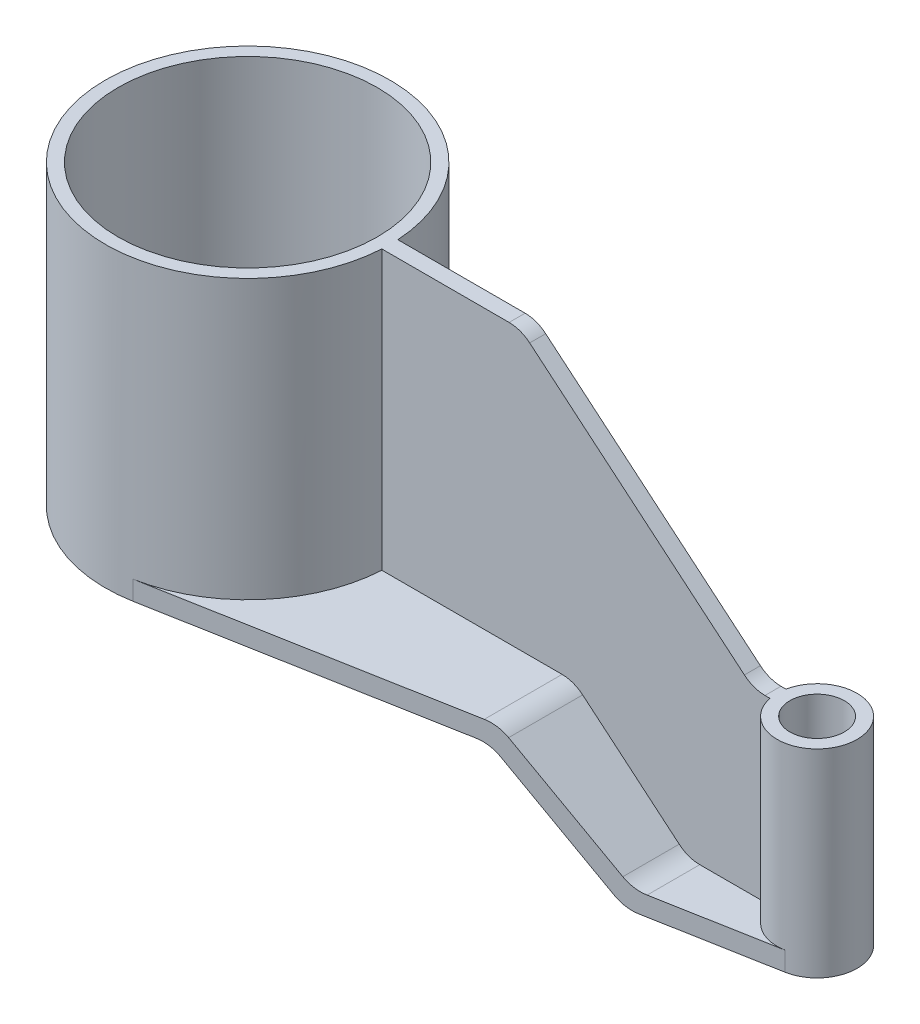
from build123d import *
from build123d.topology import SkipClean

# Parameters (mm, degrees)
SKETCH2_R                = 44.5
BOSS_EXTRUDE1_DEPTH      = 93
BOSS_EXTRUDE2_START      = -30
SKETCH2_3_R              = 12.5
BOSS_EXTRUDE2_DEPTH      = 62
EXTRUDE_THIN1_DEPTH      = 115
CUT_EXTRUDE1_START       = -30
CUT_EXTRUDE1_OUTLINE_R   = 8.5
CUT_EXTRUDE1_OUTLINE_R_2 = 40.5
CUT_EXTRUDE1_DEPTH       = 123
RIB1_START               = -2.5
RIB1_DEPTH               = 5
FILLET1_R                = 10


# Read off the part's stored shape, not the designer's step: Cut-Extrude1, Rib1
with BuildPart() as part:
    # Sketch2 → Boss-Extrude1 (new body)
    with BuildSketch(Plane(origin=(0, 0, 0), x_dir=(1, 0, 0), z_dir=(0, 1, 0))):
        with Locations(Location((0, 0, 0), (0, 0, 90))):
            Circle(SKETCH2_R)
    extrude(amount=BOSS_EXTRUDE1_DEPTH)



with BuildPart() as body_2:
    # Sketch2<3> → Boss-Extrude2 (new body)
    with BuildSketch(Plane(origin=(0, 0, 0), x_dir=(1, 0, 0), z_dir=(0, 1, 0)).offset(BOSS_EXTRUDE2_START)):
        with Locations(Location((178, 0, 0), (0, 0, 270))):
            Circle(SKETCH2_3_R)
    extrude(amount=BOSS_EXTRUDE2_DEPTH)


with BuildPart() as part_1:
    add(part.part)

    add(body_2.part)  # Extrude-Thin1 merges body 2
    # Sketch3 → Extrude-Thin1 (add, symmetric)
    with BuildSketch(Plane.XY):
        Polygon((-44.5, 0), (102.247392222, 0), (138, -30), (190.5, -30), (190.5, -24), (140.183821406, -24), (104.431213628, 6), (-44.5, 6), align=None)
    extrude(amount=EXTRUDE_THIN1_DEPTH, both=True)

    # Cut-Extrude1 outline → Cut-Extrude1 (cut)
    with SkipClean():  # the faces are left unmerged after this step: merging them gives an invalid solid
        with BuildSketch(Plane(origin=(0, 0, 0), x_dir=(1, 0, 0), z_dir=(0, 1, 0)).offset(CUT_EXTRUDE1_START)):
            with Locations((178, 0)):
                Circle(CUT_EXTRUDE1_OUTLINE_R)
            with BuildLine():
                ThreePointArc((-44.5, 0), (-28.497806933, 34.1778437), (8, 43.774992861))
                Line((8, 43.774992861), (180.247191011, 12.296346309))
                ThreePointArc((180.247191011, 12.296346309), (187.600517893, 8.005001948), (190.5, 0))
                Line((190.5, 0), (190.5, 115))
                Line((190.5, 115), (-44.5, 115))
                Line((-44.5, 115), (-44.5, 0))
            make_face()
            with BuildLine():
                ThreePointArc((8, -43.774992861), (-28.497806933, -34.1778437), (-44.5, 0))
                Line((-44.5, 0), (-44.5, -115))
                Line((-44.5, -115), (190.5, -115))
                Line((190.5, -115), (190.5, 0))
                ThreePointArc((190.5, 0), (187.600517893, -8.005001948), (180.247191011, -12.296346309))
                Line((180.247191011, -12.296346309), (8, -43.774992861))
            make_face()
            Circle(CUT_EXTRUDE1_OUTLINE_R_2)
        extrude(amount=CUT_EXTRUDE1_DEPTH, mode=Mode.SUBTRACT)

    # Rib1 outline → Rib1 (add)
    with BuildSketch(Plane.XY.offset(RIB1_START)):
        Polygon((160.566154525, 32), (87.869185376, 93), (43, 93), (43, 6), (104.431213628, 6), (140.183821406, -24), (167, -24), (167, 32), align=None)
    extrude(amount=RIB1_DEPTH)

    # Fillet1
    fillet1_edges = [part_1.edges().sort_by_distance(p)[0] for p in [
        (140.183821406, -24, -11.05901849),
        (104.431213628, 6, -14.325962052),
        (160.566154525, 32, 0),
        (87.869185376, 93, 0),
        (102.247392222, 0, 0),
        (104.431213628, 6, 14.325962052),
        (140.183821406, -24, 11.05901849),
        (138, -30, 0),
    ]]
    fillet(fillet1_edges, radius=FILLET1_R)


solid = part_1.part
